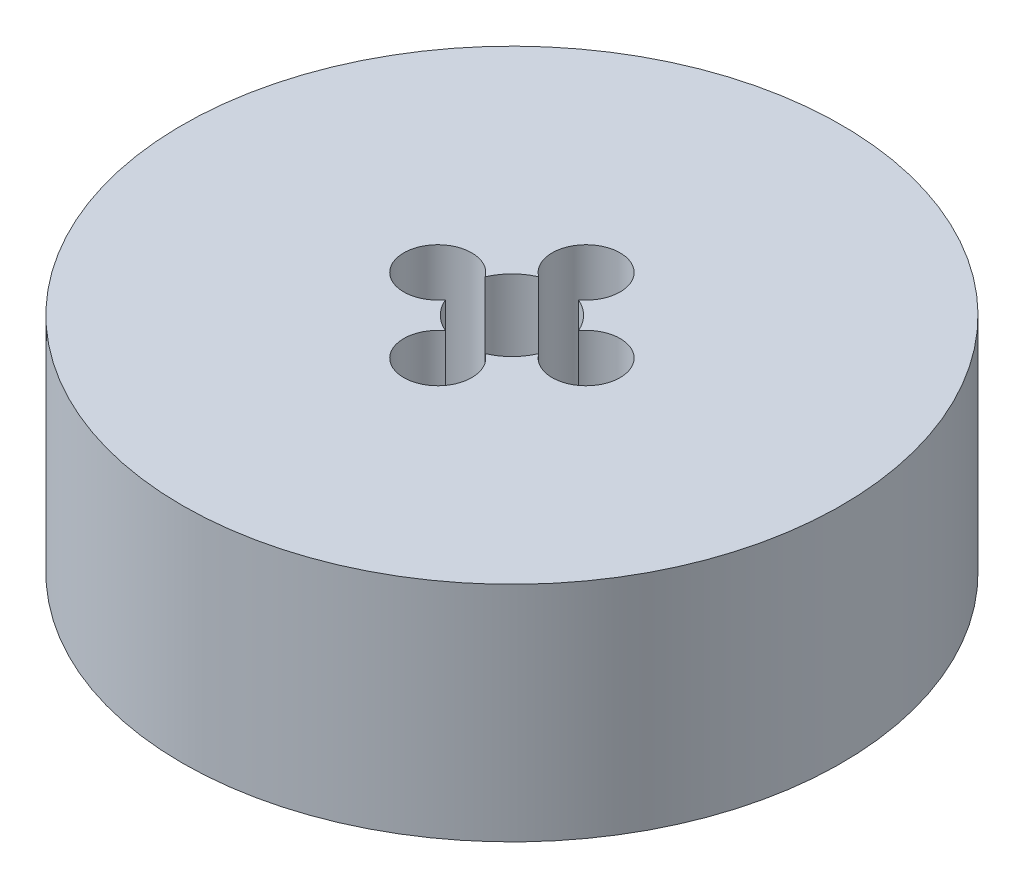
from build123d import *

# Parameters (mm, degrees)
SKETCH1_R           = 32.5
BOSS_EXTRUDE1_DEPTH = 22
SKETCH2_R           = 5
CUT_EXTRUDE1_DEPTH  = 51.955863254
SKETCH3_R           = 3.349250155
CUT_EXTRUDE2_DEPTH  = 18.804912895
CIRPATTERN1_COUNT   = 4


with BuildPart() as part:
    # Sketch1 → Boss-Extrude1 (new body)
    with BuildSketch(Plane(origin=(0, 0, 0), x_dir=(1, 0, 0), z_dir=(0, 1, 0))):
        Circle(SKETCH1_R)
    extrude(amount=BOSS_EXTRUDE1_DEPTH)

    # Sketch2 → Cut-Extrude1 (cut, through all)
    with BuildSketch(Plane(origin=(0, 0, 0), x_dir=(1, 0, 0), z_dir=(0, 1, 0))):
        Circle(SKETCH2_R)
    extrude(amount=CUT_EXTRUDE1_DEPTH, mode=Mode.SUBTRACT)

    # Sketch3 → Cut-Extrude2 (cut)
    with BuildSketch(Plane(origin=(0, 22, 0), x_dir=(1, 0, 0), z_dir=(0, 1, 0))):
        with Locations((-7.315673523, 0)):
            Circle(SKETCH3_R)
    cut_extrude2 = extrude(amount=-CUT_EXTRUDE2_DEPTH, mode=Mode.SUBTRACT)

    # CirPattern1: Cut-Extrude2 ×4 about axis
    cirpattern1_axis = Axis((0, 0, 0), (0, 1, 0))
    for i in range(1, CIRPATTERN1_COUNT):
        add(cut_extrude2.rotate(cirpattern1_axis, i * 360 / CIRPATTERN1_COUNT), mode=Mode.SUBTRACT)


solid = part.part
